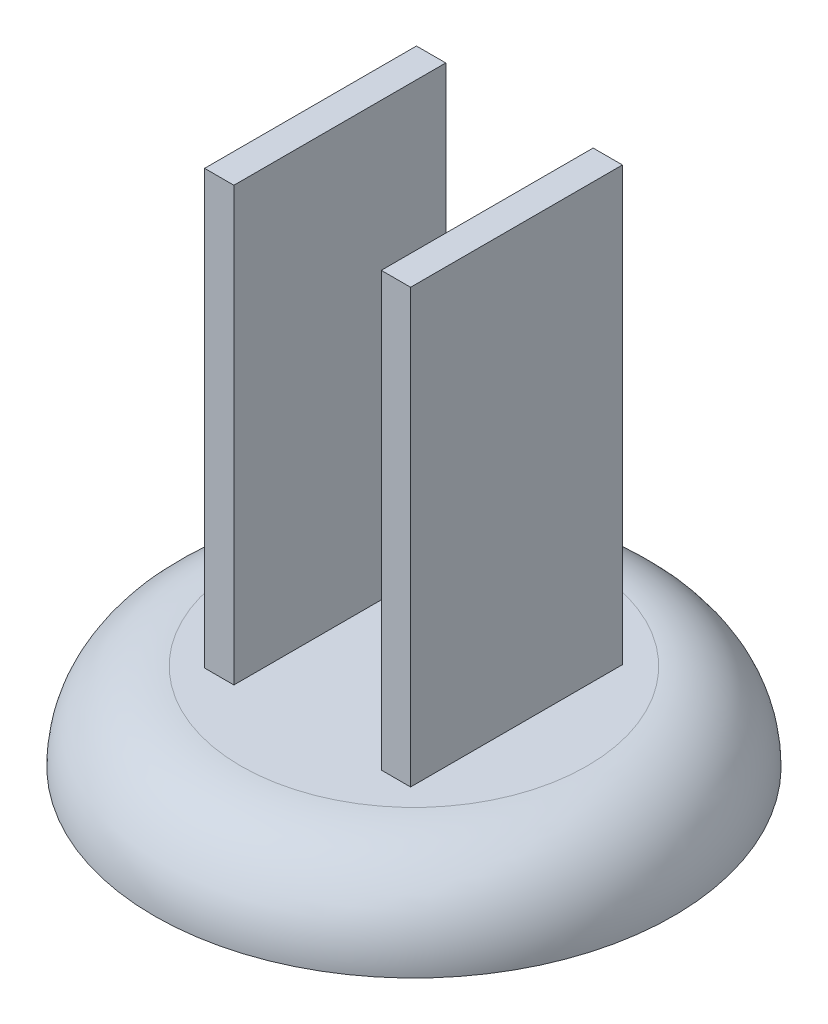
from build123d import *

# Parameters (mm, degrees)
SKETCH1_R           = 3
BOSS_EXTRUDE2_DEPTH = 1
FILLET3_R           = 1
SKETCH4_W           = 0.338616022
SKETCH4_H           = 2.447710107
BOSS_EXTRUDE3_DEPTH = 5


with BuildPart() as part:
    # Sketch1 → Boss-Extrude2 (new body)
    with BuildSketch(Plane(origin=(0, 0, 0), x_dir=(1, 0, 0), z_dir=(0, 1, 0))):
        with Locations(Location((0, 0, 0), (0, 0, 270))):
            Circle(SKETCH1_R)
    extrude(amount=BOSS_EXTRUDE2_DEPTH)

    # Fillet3
    fillet3_edges = [part.edges().sort_by_distance(p)[0] for p in [
        (0, 1, -3),
    ]]
    fillet(fillet3_edges, radius=FILLET3_R - 0.0001)  # a hair under: the kernel refuses the full size

    # Sketch4 → Boss-Extrude3 (add)
    with BuildSketch(Plane(origin=(0, 1, 0), x_dir=(1, 0, 0), z_dir=(0, 1, 0))):
        with Locations((1.02068544, -0.004837371)):
            Rectangle(SKETCH4_W, SKETCH4_H)
        with Locations((-1.02068544, -0.004837371)):
            Rectangle(SKETCH4_W, SKETCH4_H)
    extrude(amount=BOSS_EXTRUDE3_DEPTH)


solid = part.part
